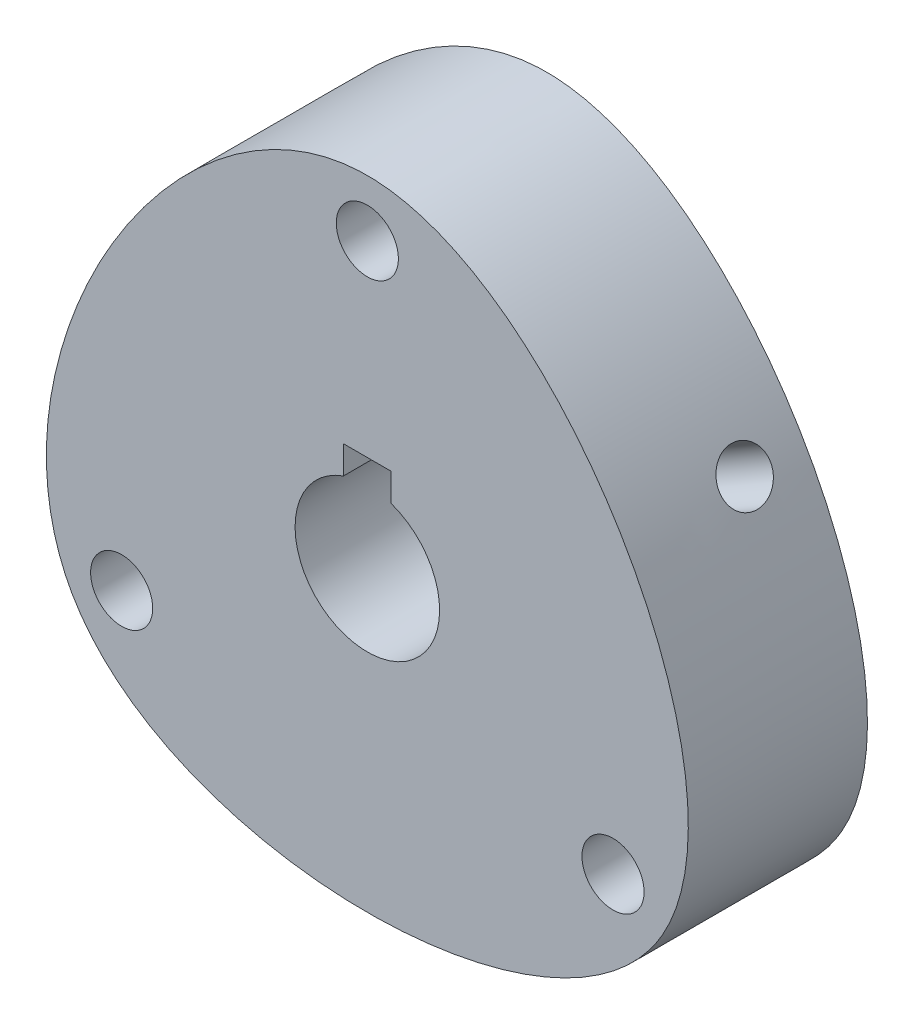
from build123d import *

# Parameters (mm, degrees)
SKETCH_1_R           = 2.6
EXTRUDE_1_DEPTH      = 15
SKETCH_13_R          = 2.15
CUT_EXTRUDE_10_DEPTH = 42.943414433
SKETCH_14_R          = 2.15
CUT_EXTRUDE_11_DEPTH = 42.943414433
SKETCH_15_R          = 4.6
CUT_EXTRUDE_12_DEPTH = 5.2


with BuildPart() as part:
    # ｽｹｯﾁ1 → ﾎﾞｽ - 押し出し1 (new body)
    with BuildSketch(Plane.XY):
        with BuildLine():
            add(Edge.make_bspline(
                [(24.681724008, -14.25), (32.908965344, 0), (-1.1e-08, 56.999999981), (-49.363447804, -28.499999633), (16.454482294, -28.500000089), (24.681724008, -14.25)],
                knots=[0, 0, 0, 0, 0.333333333, 0.666666668, 0.999999999, 0.999999999, 0.999999999, 0.999999999], degree=3))
        make_face()
        with Locations((-20.56810334, -11.875)):
            Circle(SKETCH_1_R, mode=Mode.SUBTRACT)
        with BuildLine():
            Line((-2, 5.709859893), (-2, 8.05))
            Line((-2, 8.05), (2, 8.05))
            Line((2, 8.05), (2, 5.709859893))
            ThreePointArc((2, 5.709859893), (0, -6.05), (-2, 5.709859893))
        make_face(mode=Mode.SUBTRACT)
        with Locations((0, 23.75)):
            Circle(SKETCH_1_R, mode=Mode.SUBTRACT)
        with Locations((20.56810334, -11.875)):
            Circle(SKETCH_1_R, mode=Mode.SUBTRACT)
    extrude(amount=EXTRUDE_1_DEPTH)

    # ｽｹｯﾁ13 → ｶｯﾄ - 押し出し10 (cut, through all)
    with BuildSketch(Plane(origin=(0, 0, 0), x_dir=(1, 0, 0), z_dir=(0, 1, 0))):
        with Locations((0, -5)):
            Circle(SKETCH_13_R)
    extrude(amount=-CUT_EXTRUDE_10_DEPTH, mode=Mode.SUBTRACT)

    # ｽｹｯﾁ14 → ｶｯﾄ - 押し出し11 (cut, through all)
    with BuildSketch(Plane(origin=(0, 0, 0), x_dir=(0, 0, 1), z_dir=(-0.8660254037844364, -0.5000000000000041, 0))):
        with Locations((5, 0)):
            Circle(SKETCH_14_R)
    extrude(amount=-CUT_EXTRUDE_11_DEPTH, mode=Mode.SUBTRACT)

    # ｽｹｯﾁ15 → ｶｯﾄ - 押し出し12 (cut)
    with BuildSketch(Plane(origin=(0, 0, 0), x_dir=(-1, 0, 0), z_dir=(0, 0, -1))):
        with Locations((-20.56810334, -11.875)):
            Circle(SKETCH_15_R)
        with Locations((0, 23.75)):
            Circle(SKETCH_15_R)
        with Locations((20.56810334, -11.875)):
            Circle(SKETCH_15_R)
    extrude(amount=-CUT_EXTRUDE_12_DEPTH, mode=Mode.SUBTRACT)


solid = part.part
